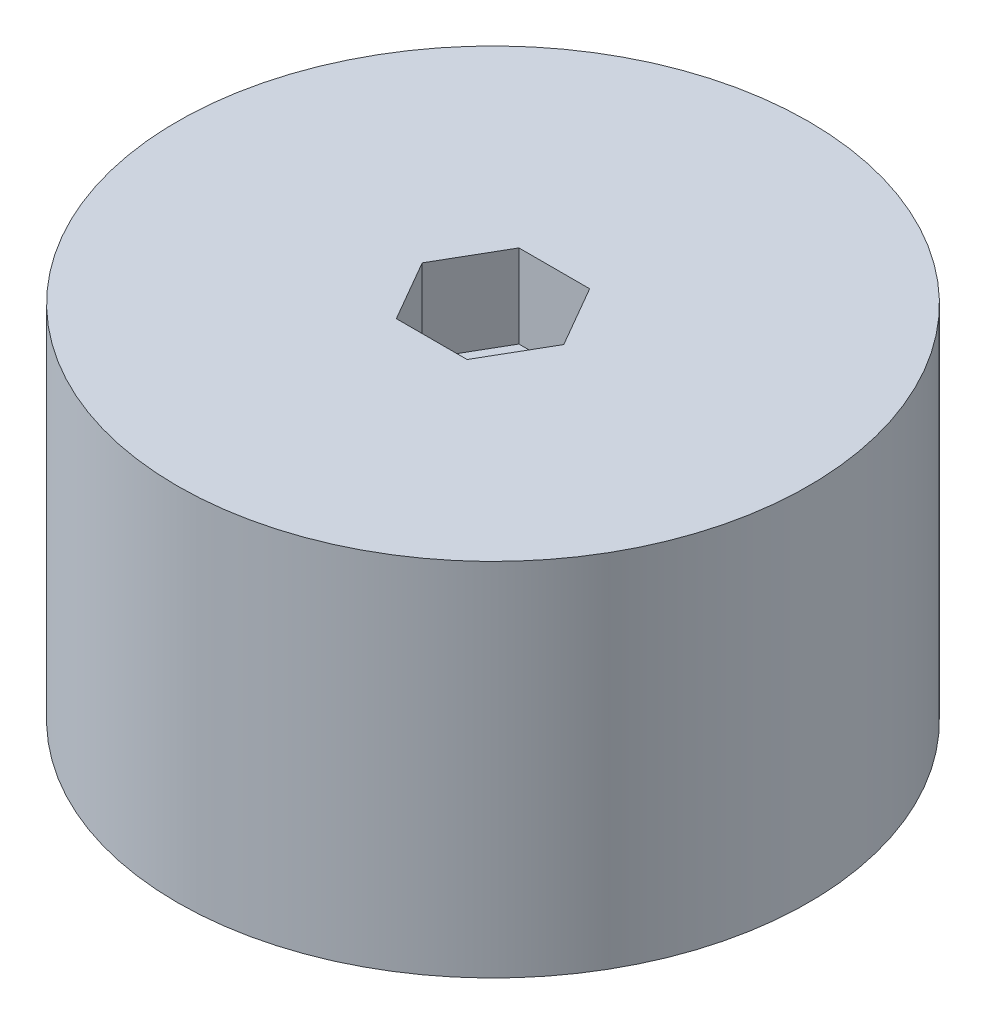
from build123d import *

# Parameters (mm, degrees)
SKETCH1_R           = 22.75
SKETCH1_R_2         = 2.5
BOSS_EXTRUDE1_DEPTH = 26
CUT_EXTRUDE1_DEPTH  = 6


with BuildPart() as part:
    # Sketch1 → Boss-Extrude1 (new body)
    with BuildSketch(Plane(origin=(0, 0, 0), x_dir=(1, 0, 0), z_dir=(0, 1, 0))):
        Circle(SKETCH1_R)
        Circle(SKETCH1_R_2, mode=Mode.SUBTRACT)
    extrude(amount=BOSS_EXTRUDE1_DEPTH)

    # Sketch2 → Cut-Extrude1 (cut)
    with BuildSketch(Plane(origin=(0, 26, 0), x_dir=(1, 0, 0), z_dir=(0, 1, 0))):
        Polygon((5.1, 0), (2.55, 4.416729559), (-2.55, 4.416729559), (-5.1, 0), (-2.55, -4.416729559), (2.55, -4.416729559), align=None)
    extrude(amount=-CUT_EXTRUDE1_DEPTH, mode=Mode.SUBTRACT)


solid = part.part
